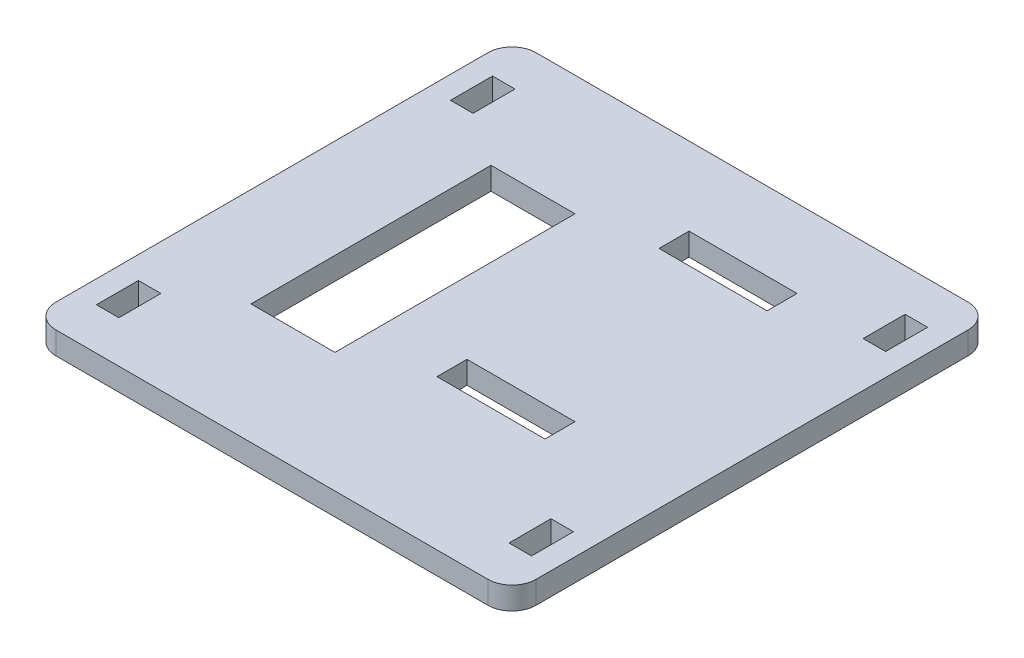
from build123d import *

# Parameters (mm, degrees)
SKETCH1_W           = 101.6
SKETCH1_H           = 101.6
SKETCH1_W_2         = 4.7625
SKETCH1_H_2         = 8.89
SKETCH1_W_3         = 17.78
SKETCH1_H_3         = 50.8
SKETCH1_W_4         = 22.86
SKETCH1_H_4         = 6.35
BOSS_EXTRUDE1_DEPTH = 4.7625
FILLET1_R           = 5.08


with BuildPart() as part:
    # Sketch1 → Boss-Extrude1 (new body)
    with BuildSketch(Plane(origin=(0, 0, 0), x_dir=(1, 0, 0), z_dir=(0, 1, 0))):
        with Locations((-50.8, 50.8)):
            Rectangle(SKETCH1_W, SKETCH1_H)
        with Locations((-94.45625, 13.335)):
            Rectangle(SKETCH1_W_2, SKETCH1_H_2, mode=Mode.SUBTRACT)
        with Locations((-94.45625, 88.265)):
            Rectangle(SKETCH1_W_2, SKETCH1_H_2, mode=Mode.SUBTRACT)
        with Locations((-71.755, 50.8)):
            Rectangle(SKETCH1_W_3, SKETCH1_H_3, mode=Mode.SUBTRACT)
        with Locations((-36.195, 81.915)):
            Rectangle(SKETCH1_W_4, SKETCH1_H_4, mode=Mode.SUBTRACT)
        with Locations((-7.14375, 13.335)):
            Rectangle(SKETCH1_W_2, SKETCH1_H_2, mode=Mode.SUBTRACT)
        with Locations((-7.14375, 88.265)):
            Rectangle(SKETCH1_W_2, SKETCH1_H_2, mode=Mode.SUBTRACT)
        with Locations((-36.195, 34.925)):
            Rectangle(SKETCH1_W_4, SKETCH1_H_4, mode=Mode.SUBTRACT)
    extrude(amount=BOSS_EXTRUDE1_DEPTH)

    # Fillet1
    fillet1_edges = [part.edges().sort_by_distance(p)[0] for p in [
        (-101.6, 2.38125, 0),
        (0, 2.38125, 0),
        (0, 2.38125, -101.6),
        (-101.6, 2.38125, -101.6),
    ]]
    fillet(fillet1_edges, radius=FILLET1_R)


solid = part.part
